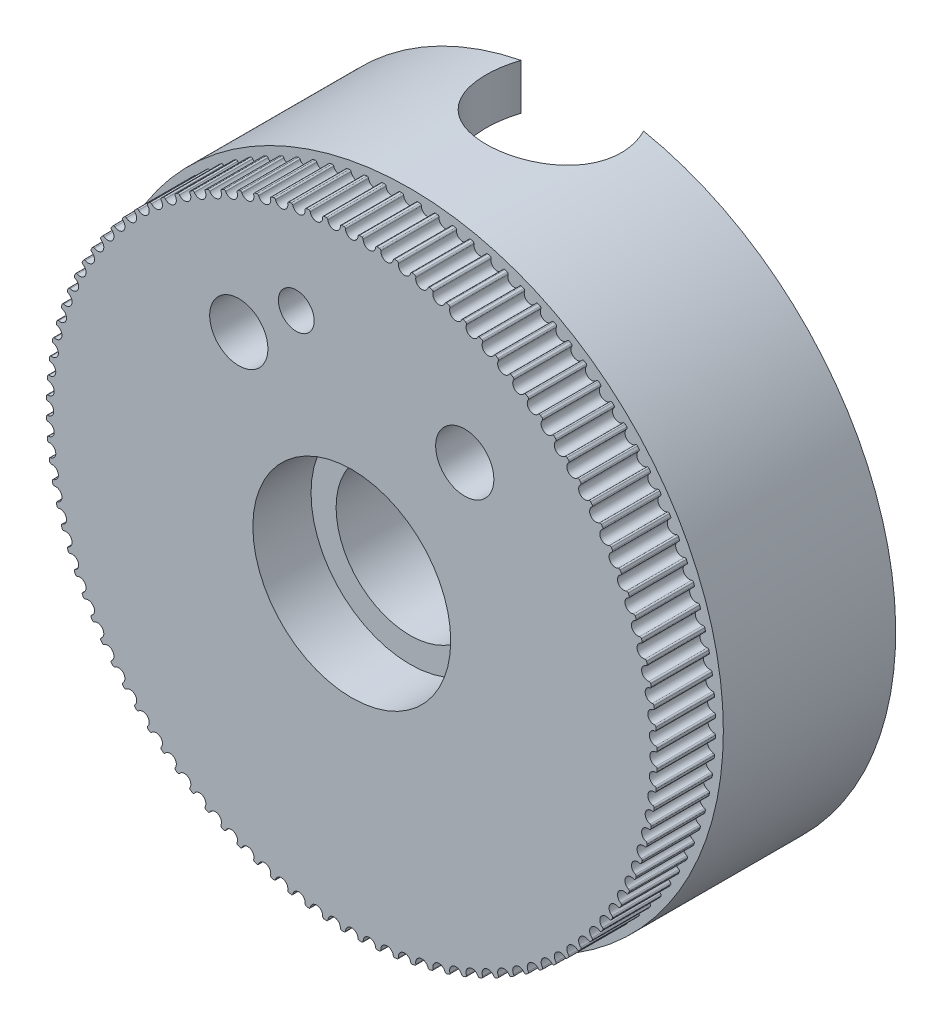
from build123d import *

# Parameters (mm, degrees)
SKETCH_1_R          = 35
SKETCH_1_R_2        = 8.25
EXTRUDE_1_DEPTH     = 19.25
SKETCH_2_R          = 7.55
CUT_EXTRUDE_1_DEPTH = 64.218371539
SKETCH_3_R          = 30
SKETCH_3_R_2        = 14.5
CUT_EXTRUDE_2_DEPTH = 8.75
SKETCH_4_R          = 8.25
EXTRUDE_2_DEPTH     = 6.5
SKETCH_6_R          = 11.05
CUT_EXTRUDE_3_DEPTH = 6.5
CUT_EXTRUDE_START   = -6.5
SKETCH_7_R          = 11.05
CUT_EXTRUDE_4_DEPTH = 6.5
SKETCH_8_R          = 1.75
CUT_EXTRUDE_5_DEPTH = 56.794825201
SKETCH_10_R         = 3.25
CUT_EXTRUDE_6_DEPTH = 10
SKETCH_12_R         = 2
CUT_EXTRUDE_7_DEPTH = 5
SKETCH_13_R         = 1.25
CUT_EXTRUDE_8_DEPTH = 54.670872158


with BuildPart() as part:
    # 草图1 → 凸台-拉伸1 (new body)
    with BuildSketch(Plane.XY):
        Circle(SKETCH_1_R)
        Circle(SKETCH_1_R_2, mode=Mode.SUBTRACT)
    extrude(amount=EXTRUDE_1_DEPTH)

    # 草图2 → 切除-拉伸1 (cut, through all)
    with BuildSketch(Plane(origin=(0, 14, 0), x_dir=(1, 0, 0), z_dir=(0, 1, 0))):
        with Locations((0, -3.2)):
            Circle(SKETCH_2_R)
    extrude(amount=CUT_EXTRUDE_1_DEPTH, mode=Mode.SUBTRACT)

    # 草图3 → 切除-拉伸2 (cut)
    with BuildSketch(Plane(origin=(0, 0, 0), x_dir=(-1, 0, 0), z_dir=(0, 0, -1))):
        Circle(SKETCH_3_R)
        Circle(SKETCH_3_R_2, mode=Mode.SUBTRACT)
    extrude(amount=-CUT_EXTRUDE_2_DEPTH, mode=Mode.SUBTRACT)

    # 草图4 → 凸台-拉伸2 (add)
    with BuildSketch(Plane.XY.offset(19.25)):
        with BuildLine():
            ThreePointArc((1.121572838, 34.104062524), (0.992443315, 34.108064479), (0.863299566, 34.111577508))
            ThreePointArc((0.863299566, 34.111577508), (0.749968837, 34.068493113), (0.699390809, 33.95830245))
            ThreePointArc((0.699390809, 33.95830245), (0, 33.2875), (-0.699390809, 33.95830245))
            ThreePointArc((-0.699390809, 33.95830245), (-0.749968837, 34.068493113), (-0.863299566, 34.111577508))
            ThreePointArc((-0.863299566, 34.111577508), (-0.992443315, 34.108064479), (-1.121572838, 34.104062524))
            ThreePointArc((-1.121572838, 34.104062524), (-1.232206695, 34.054461424), (-1.276292136, 33.941516335))
            ThreePointArc((-1.276292136, 33.941516335), (-1.935495992, 33.231182818), (-2.672707236, 33.860184418))
            ThreePointArc((-2.672707236, 33.860184418), (-2.729606712, 33.967247805), (-2.845250838, 34.003669713))
            ThreePointArc((-2.845250838, 34.003669713), (-2.973971832, 33.992653586), (-3.102650195, 33.981150187))
            ThreePointArc((-3.102650195, 33.981150187), (-3.210212829, 33.925200218), (-3.247656512, 33.809882874))
            ThreePointArc((-3.247656512, 33.809882874), (-3.864442879, 33.062421833), (-4.636980068, 33.64749424))
            ThreePointArc((-4.636980068, 33.64749424), (-4.700008462, 33.751068082), (-4.817574682, 33.780704262))
            ThreePointArc((-4.817574682, 33.780704262), (-4.945437369, 33.762222312), (-5.073229166, 33.743256394))
            ThreePointArc((-5.073229166, 33.743256394), (-5.17735662, 33.681146873), (-5.208031846, 33.563847471))
            ThreePointArc((-5.208031846, 33.563847471), (-5.780313714, 32.781788078), (-6.585562828, 33.320951592))
            ThreePointArc((-6.585562828, 33.320951592), (-6.65450687, 33.420685429), (-6.773597378, 33.443435601))
            ThreePointArc((-6.773597378, 33.443435601), (-6.900169112, 33.417550366), (-7.026641935, 33.391186103))
            ThreePointArc((-7.026641935, 33.391186103), (-7.126981874, 33.323127188), (-7.15078485, 33.204242632))
            ThreePointArc((-7.15078485, 33.204242632), (-7.676625797, 32.390231129), (-8.511862127, 32.881661392))
            ThreePointArc((-8.511862127, 32.881661392), (-8.586488534, 32.977217756), (-8.706700364, 32.993004941))
            ThreePointArc((-8.706700364, 32.993004941), (-8.831552867, 32.959804008), (-8.956278772, 32.926130608))
            ThreePointArc((-8.956278772, 32.926130608), (-9.052491678, 32.85235259), (-9.06934186, 32.732285148))
            ThreePointArc((-9.06934186, 32.732285148), (-9.546962609, 31.889075891), (-10.40935998, 32.331110058))
            ThreePointArc((-10.40935998, 32.331110058), (-10.489416239, 32.422165616), (-10.610342633, 32.430936395))
            ThreePointArc((-10.610342633, 32.430936395), (-10.733053442, 32.390532105), (-10.855610397, 32.349663509))
            ThreePointArc((-10.855610397, 32.349663509), (-10.947370715, 32.270416029), (-10.957211089, 32.149571971))
            ThreePointArc((-10.957211089, 32.149571971), (-11.384995521, 31.280018114), (-12.271635853, 31.671160482))
            ThreePointArc((-12.271635853, 31.671160482), (-12.35685108, 31.75740713), (-12.47808286, 31.759131827))
            ThreePointArc((-12.47808286, 31.759131827), (-12.598236762, 31.711660895), (-12.718210072, 31.663735389))
            ThreePointArc((-12.718210072, 31.663735389), (-12.805207316, 31.579286595), (-12.808004584, 31.458074819))
            ThreePointArc((-12.808004584, 31.458074819), (-13.184505212, 30.565118658), (-14.092388395, 30.904045724))
            ThreePointArc((-14.092388395, 30.904045724), (-14.182474247, 30.985191632), (-14.303601206, 30.979864409))
            ThreePointArc((-14.303601206, 30.979864409), (-14.420791636, 30.925487463), (-14.53777535, 30.870667212))
            ThreePointArc((-14.53777535, 30.870667212), (-14.619715148, 30.781302852), (-14.615459846, 30.6601335))
            ThreePointArc((-14.615459846, 30.6601335), (-14.939402711, 29.746796515), (-15.865456755, 30.032361457))
            ThreePointArc((-15.865456755, 30.032361457), (-15.960108412, 30.108132053), (-16.080720692, 30.095770937))
            ThreePointArc((-16.080720692, 30.095770937), (-16.194551117, 30.034671971), (-16.308149399, 29.973142469))
            ThreePointArc((-16.308149399, 29.973142469), (-16.384754491, 29.879164923), (-16.373461017, 29.758447995))
            ThreePointArc((-16.373461017, 29.758447995), (-16.64375, 28.827820628), (-17.584841432, 29.059057186))
            ThreePointArc((-17.584841432, 29.059057186), (-17.683738622, 29.129196086), (-17.80342811, 29.109842902))
            ThreePointArc((-17.80342811, 29.109842902), (-17.913513362, 29.042228655), (-18.023341832, 28.974198099))
            ThreePointArc((-18.023341832, 28.974198099), (-18.094353013, 28.875925358), (-18.07605958, 28.756069321))
            ThreePointArc((-18.07605958, 28.756069321), (-18.291780108, 27.811300522), (-19.244724572, 27.987426264))
            ThreePointArc((-19.244724572, 27.987426264), (-19.347532657, 28.05169614), (-19.465894362, 28.025416374))
            ThreePointArc((-19.465894362, 28.025416374), (-19.571861949, 27.951515631), (-19.677548981, 27.877214214))
            ThreePointArc((-19.677548981, 27.877214214), (-19.742725971, 27.774978803), (-19.717494479, 27.656389212))
            ThreePointArc((-19.717494479, 27.656389212), (-19.877916621, 26.700675779), (-20.839489656, 26.821094751))
            ThreePointArc((-20.839489656, 26.821094751), (-20.945860767, 26.879278133), (-21.06249419, 26.846160708))
            ThreePointArc((-21.06249419, 26.846160708), (-21.163985551, 26.766223526), (-21.265173534, 26.685902661))
            ThreePointArc((-21.265173534, 26.685902661), (-21.324295793, 26.580050511), (-21.292211618, 26.463128635))
            ThreePointArc((-21.292211618, 26.463128635), (-21.396792557, 25.4997044), (-22.363740503, 25.564009143))
            ThreePointArc((-22.363740503, 25.564009143), (-22.473314714, 25.615909158), (-22.587825205, 25.576066132))
            ThreePointArc((-22.587825205, 25.576066132), (-22.684496924, 25.490362993), (-22.78084347, 25.40429446))
            ThreePointArc((-22.78084347, 25.40429446), (-22.833710949, 25.295183742), (-22.794882653, 25.180325208))
            ThreePointArc((-22.794882653, 25.180325208), (-22.843268521, 24.212450094), (-23.812319532, 24.22042302))
            ThreePointArc((-23.812319532, 24.22042302), (-23.924726078, 24.265864055), (-24.036726169, 24.219430244))
            ThreePointArc((-24.036726169, 24.219430244), (-24.128251141, 24.128251141), (-24.219430244, 24.036726169))
            ThreePointArc((-24.219430244, 24.036726169), (-24.265864055, 23.924726078), (-24.22042302, 23.812319532))
            ThreePointArc((-24.22042302, 23.812319532), (-24.212450094, 22.843268521), (-25.180325208, 22.794882653))
            ThreePointArc((-25.180325208, 22.794882653), (-25.295183742, 22.833710949), (-25.40429446, 22.78084347))
            ThreePointArc((-25.40429446, 22.78084347), (-25.490362993, 22.684496924), (-25.576066132, 22.587825205))
            ThreePointArc((-25.576066132, 22.587825205), (-25.615909158, 22.473314714), (-25.564009143, 22.363740503))
            ThreePointArc((-25.564009143, 22.363740503), (-25.4997044, 21.396792557), (-26.463128635, 21.292211618))
            ThreePointArc((-26.463128635, 21.292211618), (-26.580050511, 21.324295793), (-26.685902661, 21.265173534))
            ThreePointArc((-26.685902661, 21.265173534), (-26.766223526, 21.163985551), (-26.846160708, 21.06249419))
            ThreePointArc((-26.846160708, 21.06249419), (-26.879278133, 20.945860767), (-26.821094751, 20.839489656))
            ThreePointArc((-26.821094751, 20.839489656), (-26.700675779, 19.877916621), (-27.656389212, 19.717494479))
            ThreePointArc((-27.656389212, 19.717494479), (-27.774978803, 19.742725971), (-27.877214214, 19.677548981))
            ThreePointArc((-27.877214214, 19.677548981), (-27.951515631, 19.571861949), (-28.025416374, 19.465894362))
            ThreePointArc((-28.025416374, 19.465894362), (-28.05169614, 19.347532657), (-27.987426264, 19.244724572))
            ThreePointArc((-27.987426264, 19.244724572), (-27.811300522, 18.291780108), (-28.756069321, 18.07605958))
            ThreePointArc((-28.756069321, 18.07605958), (-28.875925358, 18.094353013), (-28.974198099, 18.023341832))
            ThreePointArc((-28.974198099, 18.023341832), (-29.042228655, 17.913513362), (-29.109842902, 17.80342811))
            ThreePointArc((-29.109842902, 17.80342811), (-29.129196086, 17.683738622), (-29.059057186, 17.584841432))
            ThreePointArc((-29.059057186, 17.584841432), (-28.827820628, 16.64375), (-29.758447995, 16.373461017))
            ThreePointArc((-29.758447995, 16.373461017), (-29.879164923, 16.384754491), (-29.973142469, 16.308149399))
            ThreePointArc((-29.973142469, 16.308149399), (-30.034671971, 16.194551117), (-30.095770937, 16.080720692))
            ThreePointArc((-30.095770937, 16.080720692), (-30.108132053, 15.960108412), (-30.032361457, 15.865456755))
            ThreePointArc((-30.032361457, 15.865456755), (-29.746796515, 14.939402711), (-30.6601335, 14.615459846))
            ThreePointArc((-30.6601335, 14.615459846), (-30.781302852, 14.619715148), (-30.870667212, 14.53777535))
            ThreePointArc((-30.870667212, 14.53777535), (-30.925487463, 14.420791636), (-30.979864409, 14.303601206))
            ThreePointArc((-30.979864409, 14.303601206), (-30.985191632, 14.182474247), (-30.904045724, 14.092388395))
            ThreePointArc((-30.904045724, 14.092388395), (-30.565118658, 13.184505212), (-31.458074819, 12.808004584))
            ThreePointArc((-31.458074819, 12.808004584), (-31.579286595, 12.805207316), (-31.663735389, 12.718210072))
            ThreePointArc((-31.663735389, 12.718210072), (-31.711660895, 12.598236762), (-31.759131827, 12.47808286))
            ThreePointArc((-31.759131827, 12.47808286), (-31.75740713, 12.35685108), (-31.671160482, 12.271635853))
            ThreePointArc((-31.671160482, 12.271635853), (-31.280018114, 11.384995521), (-32.149571971, 10.957211089))
            ThreePointArc((-32.149571971, 10.957211089), (-32.270416029, 10.947370715), (-32.349663509, 10.855610397))
            ThreePointArc((-32.349663509, 10.855610397), (-32.390532105, 10.733053442), (-32.430936395, 10.610342633))
            ThreePointArc((-32.430936395, 10.610342633), (-32.422165616, 10.489416239), (-32.331110058, 10.40935998))
            ThreePointArc((-32.331110058, 10.40935998), (-31.889075891, 9.546962609), (-32.732285148, 9.06934186))
            ThreePointArc((-32.732285148, 9.06934186), (-32.85235259, 9.052491678), (-32.926130608, 8.956278772))
            ThreePointArc((-32.926130608, 8.956278772), (-32.959804008, 8.831552867), (-32.993004941, 8.706700364))
            ThreePointArc((-32.993004941, 8.706700364), (-32.977217756, 8.586488534), (-32.881661392, 8.511862127))
            ThreePointArc((-32.881661392, 8.511862127), (-32.390231129, 7.676625797), (-33.204242632, 7.15078485))
            ThreePointArc((-33.204242632, 7.15078485), (-33.323127188, 7.126981874), (-33.391186103, 7.026641935))
            ThreePointArc((-33.391186103, 7.026641935), (-33.417550366, 6.900169112), (-33.443435601, 6.773597378))
            ThreePointArc((-33.443435601, 6.773597378), (-33.420685429, 6.65450687), (-33.320951592, 6.585562828))
            ThreePointArc((-33.320951592, 6.585562828), (-32.781788078, 5.780313714), (-33.563847471, 5.208031846))
            ThreePointArc((-33.563847471, 5.208031846), (-33.681146873, 5.17735662), (-33.743256394, 5.073229166))
            ThreePointArc((-33.743256394, 5.073229166), (-33.762222312, 4.945437369), (-33.780704262, 4.817574682))
            ThreePointArc((-33.780704262, 4.817574682), (-33.751068082, 4.700008462), (-33.64749424, 4.636980068))
            ThreePointArc((-33.64749424, 4.636980068), (-33.062421833, 3.864442879), (-33.809882874, 3.247656512))
            ThreePointArc((-33.809882874, 3.247656512), (-33.925200218, 3.210212829), (-33.981150187, 3.102650195))
            ThreePointArc((-33.981150187, 3.102650195), (-33.992653586, 2.973971832), (-34.003669713, 2.845250838))
            ThreePointArc((-34.003669713, 2.845250838), (-33.967247805, 2.729606712), (-33.860184418, 2.672707236))
            ThreePointArc((-33.860184418, 2.672707236), (-33.231182818, 1.935495992), (-33.941516335, 1.276292136))
            ThreePointArc((-33.941516335, 1.276292136), (-34.054461424, 1.232206695), (-34.104062524, 1.121572838))
            ThreePointArc((-34.104062524, 1.121572838), (-34.108064479, 0.992443315), (-34.111577508, 0.863299566))
            ThreePointArc((-34.111577508, 0.863299566), (-34.068493113, 0.749968837), (-33.95830245, 0.699390809))
            ThreePointArc((-33.95830245, 0.699390809), (-33.2875, 0), (-33.95830245, -0.699390809))
            ThreePointArc((-33.95830245, -0.699390809), (-34.068493113, -0.749968837), (-34.111577508, -0.863299566))
            ThreePointArc((-34.111577508, -0.863299566), (-34.108064479, -0.992443315), (-34.104062524, -1.121572838))
            ThreePointArc((-34.104062524, -1.121572838), (-34.054461424, -1.232206695), (-33.941516335, -1.276292136))
            ThreePointArc((-33.941516335, -1.276292136), (-33.231182818, -1.935495992), (-33.860184418, -2.672707236))
            ThreePointArc((-33.860184418, -2.672707236), (-33.967247805, -2.729606712), (-34.003669713, -2.845250838))
            ThreePointArc((-34.003669713, -2.845250838), (-33.992653586, -2.973971832), (-33.981150187, -3.102650195))
            ThreePointArc((-33.981150187, -3.102650195), (-33.925200218, -3.210212829), (-33.809882874, -3.247656512))
            ThreePointArc((-33.809882874, -3.247656512), (-33.062421833, -3.864442879), (-33.64749424, -4.636980068))
            ThreePointArc((-33.64749424, -4.636980068), (-33.751068082, -4.700008462), (-33.780704262, -4.817574682))
            ThreePointArc((-33.780704262, -4.817574682), (-33.762222312, -4.945437369), (-33.743256394, -5.073229166))
            ThreePointArc((-33.743256394, -5.073229166), (-33.681146873, -5.17735662), (-33.563847471, -5.208031846))
            ThreePointArc((-33.563847471, -5.208031846), (-32.781788078, -5.780313714), (-33.320951592, -6.585562828))
            ThreePointArc((-33.320951592, -6.585562828), (-33.420685429, -6.65450687), (-33.443435601, -6.773597378))
            ThreePointArc((-33.443435601, -6.773597378), (-33.417550366, -6.900169112), (-33.391186103, -7.026641935))
            ThreePointArc((-33.391186103, -7.026641935), (-33.323127188, -7.126981874), (-33.204242632, -7.15078485))
            ThreePointArc((-33.204242632, -7.15078485), (-32.390231129, -7.676625797), (-32.881661392, -8.511862127))
            ThreePointArc((-32.881661392, -8.511862127), (-32.977217756, -8.586488534), (-32.993004941, -8.706700364))
            ThreePointArc((-32.993004941, -8.706700364), (-32.959804008, -8.831552867), (-32.926130608, -8.956278772))
            ThreePointArc((-32.926130608, -8.956278772), (-32.85235259, -9.052491678), (-32.732285148, -9.06934186))
            ThreePointArc((-32.732285148, -9.06934186), (-31.889075891, -9.546962609), (-32.331110058, -10.40935998))
            ThreePointArc((-32.331110058, -10.40935998), (-32.422165616, -10.489416239), (-32.430936395, -10.610342633))
            ThreePointArc((-32.430936395, -10.610342633), (-32.390532105, -10.733053442), (-32.349663509, -10.855610397))
            ThreePointArc((-32.349663509, -10.855610397), (-32.270416029, -10.947370715), (-32.149571971, -10.957211089))
            ThreePointArc((-32.149571971, -10.957211089), (-31.280018114, -11.384995521), (-31.671160482, -12.271635853))
            ThreePointArc((-31.671160482, -12.271635853), (-31.75740713, -12.35685108), (-31.759131827, -12.47808286))
            ThreePointArc((-31.759131827, -12.47808286), (-31.711660895, -12.598236762), (-31.663735389, -12.718210072))
            ThreePointArc((-31.663735389, -12.718210072), (-31.579286595, -12.805207316), (-31.458074819, -12.808004584))
            ThreePointArc((-31.458074819, -12.808004584), (-30.565118658, -13.184505212), (-30.904045724, -14.092388395))
            ThreePointArc((-30.904045724, -14.092388395), (-30.985191632, -14.182474247), (-30.979864409, -14.303601206))
            ThreePointArc((-30.979864409, -14.303601206), (-30.925487463, -14.420791636), (-30.870667212, -14.53777535))
            ThreePointArc((-30.870667212, -14.53777535), (-30.781302852, -14.619715148), (-30.6601335, -14.615459846))
            ThreePointArc((-30.6601335, -14.615459846), (-29.746796515, -14.939402711), (-30.032361457, -15.865456755))
            ThreePointArc((-30.032361457, -15.865456755), (-30.108132053, -15.960108412), (-30.095770937, -16.080720692))
            ThreePointArc((-30.095770937, -16.080720692), (-30.034671971, -16.194551117), (-29.973142469, -16.308149399))
            ThreePointArc((-29.973142469, -16.308149399), (-29.879164923, -16.384754491), (-29.758447995, -16.373461017))
            ThreePointArc((-29.758447995, -16.373461017), (-28.827820628, -16.64375), (-29.059057186, -17.584841432))
            ThreePointArc((-29.059057186, -17.584841432), (-29.129196086, -17.683738622), (-29.109842902, -17.80342811))
            ThreePointArc((-29.109842902, -17.80342811), (-29.042228655, -17.913513362), (-28.974198099, -18.023341832))
            ThreePointArc((-28.974198099, -18.023341832), (-28.875925358, -18.094353013), (-28.756069321, -18.07605958))
            ThreePointArc((-28.756069321, -18.07605958), (-27.811300522, -18.291780108), (-27.987426264, -19.244724572))
            ThreePointArc((-27.987426264, -19.244724572), (-28.05169614, -19.347532657), (-28.025416374, -19.465894362))
            ThreePointArc((-28.025416374, -19.465894362), (-27.951515631, -19.571861949), (-27.877214214, -19.677548981))
            ThreePointArc((-27.877214214, -19.677548981), (-27.774978803, -19.742725971), (-27.656389212, -19.717494479))
            ThreePointArc((-27.656389212, -19.717494479), (-26.700675779, -19.877916621), (-26.821094751, -20.839489656))
            ThreePointArc((-26.821094751, -20.839489656), (-26.879278133, -20.945860767), (-26.846160708, -21.06249419))
            ThreePointArc((-26.846160708, -21.06249419), (-26.766223526, -21.163985551), (-26.685902661, -21.265173534))
            ThreePointArc((-26.685902661, -21.265173534), (-26.580050511, -21.324295793), (-26.463128635, -21.292211618))
            ThreePointArc((-26.463128635, -21.292211618), (-25.4997044, -21.396792557), (-25.564009143, -22.363740503))
            ThreePointArc((-25.564009143, -22.363740503), (-25.615909158, -22.473314714), (-25.576066132, -22.587825205))
            ThreePointArc((-25.576066132, -22.587825205), (-25.490362993, -22.684496924), (-25.40429446, -22.78084347))
            ThreePointArc((-25.40429446, -22.78084347), (-25.295183742, -22.833710949), (-25.180325208, -22.794882653))
            ThreePointArc((-25.180325208, -22.794882653), (-24.212450094, -22.843268521), (-24.22042302, -23.812319532))
            ThreePointArc((-24.22042302, -23.812319532), (-24.265864055, -23.924726078), (-24.219430244, -24.036726169))
            ThreePointArc((-24.219430244, -24.036726169), (-24.128251141, -24.128251141), (-24.036726169, -24.219430244))
            ThreePointArc((-24.036726169, -24.219430244), (-23.924726078, -24.265864055), (-23.812319532, -24.22042302))
            ThreePointArc((-23.812319532, -24.22042302), (-22.843268521, -24.212450094), (-22.794882653, -25.180325208))
            ThreePointArc((-22.794882653, -25.180325208), (-22.833710949, -25.295183742), (-22.78084347, -25.40429446))
            ThreePointArc((-22.78084347, -25.40429446), (-22.684496924, -25.490362993), (-22.587825205, -25.576066132))
            ThreePointArc((-22.587825205, -25.576066132), (-22.473314714, -25.615909158), (-22.363740503, -25.564009143))
            ThreePointArc((-22.363740503, -25.564009143), (-21.396792557, -25.4997044), (-21.292211618, -26.463128635))
            ThreePointArc((-21.292211618, -26.463128635), (-21.324295793, -26.580050511), (-21.265173534, -26.685902661))
            ThreePointArc((-21.265173534, -26.685902661), (-21.163985551, -26.766223526), (-21.06249419, -26.846160708))
            ThreePointArc((-21.06249419, -26.846160708), (-20.945860767, -26.879278133), (-20.839489656, -26.821094751))
            ThreePointArc((-20.839489656, -26.821094751), (-19.877916621, -26.700675779), (-19.717494479, -27.656389212))
            ThreePointArc((-19.717494479, -27.656389212), (-19.742725971, -27.774978803), (-19.677548981, -27.877214214))
            ThreePointArc((-19.677548981, -27.877214214), (-19.571861949, -27.951515631), (-19.465894362, -28.025416374))
            ThreePointArc((-19.465894362, -28.025416374), (-19.347532657, -28.05169614), (-19.244724572, -27.987426264))
            ThreePointArc((-19.244724572, -27.987426264), (-18.291780108, -27.811300522), (-18.07605958, -28.756069321))
            ThreePointArc((-18.07605958, -28.756069321), (-18.094353013, -28.875925358), (-18.023341832, -28.974198099))
            ThreePointArc((-18.023341832, -28.974198099), (-17.913513362, -29.042228655), (-17.80342811, -29.109842902))
            ThreePointArc((-17.80342811, -29.109842902), (-17.683738622, -29.129196086), (-17.584841432, -29.059057186))
            ThreePointArc((-17.584841432, -29.059057186), (-16.64375, -28.827820628), (-16.373461017, -29.758447995))
            ThreePointArc((-16.373461017, -29.758447995), (-16.384754491, -29.879164923), (-16.308149399, -29.973142469))
            ThreePointArc((-16.308149399, -29.973142469), (-16.194551117, -30.034671971), (-16.080720692, -30.095770937))
            ThreePointArc((-16.080720692, -30.095770937), (-15.960108412, -30.108132053), (-15.865456755, -30.032361457))
            ThreePointArc((-15.865456755, -30.032361457), (-14.939402711, -29.746796515), (-14.615459846, -30.6601335))
            ThreePointArc((-14.615459846, -30.6601335), (-14.619715148, -30.781302852), (-14.53777535, -30.870667212))
            ThreePointArc((-14.53777535, -30.870667212), (-14.420791636, -30.925487463), (-14.303601205, -30.979864409))
            ThreePointArc((-14.303601205, -30.979864409), (-14.182474247, -30.985191632), (-14.092388395, -30.904045724))
            ThreePointArc((-14.092388395, -30.904045724), (-13.184505212, -30.565118658), (-12.808004584, -31.458074819))
            ThreePointArc((-12.808004584, -31.458074819), (-12.805207316, -31.579286595), (-12.718210072, -31.663735389))
            ThreePointArc((-12.718210072, -31.663735389), (-12.598236762, -31.711660895), (-12.47808286, -31.759131827))
            ThreePointArc((-12.47808286, -31.759131827), (-12.35685108, -31.75740713), (-12.271635853, -31.671160482))
            ThreePointArc((-12.271635853, -31.671160482), (-11.384995521, -31.280018114), (-10.957211089, -32.149571971))
            ThreePointArc((-10.957211089, -32.149571971), (-10.947370715, -32.270416029), (-10.855610397, -32.349663509))
            ThreePointArc((-10.855610397, -32.349663509), (-10.733053442, -32.390532105), (-10.610342633, -32.430936395))
            ThreePointArc((-10.610342633, -32.430936395), (-10.489416239, -32.422165616), (-10.40935998, -32.331110058))
            ThreePointArc((-10.40935998, -32.331110058), (-9.546962609, -31.889075891), (-9.06934186, -32.732285148))
            ThreePointArc((-9.06934186, -32.732285148), (-9.052491678, -32.85235259), (-8.956278772, -32.926130608))
            ThreePointArc((-8.956278772, -32.926130608), (-8.831552867, -32.959804008), (-8.706700364, -32.993004941))
            ThreePointArc((-8.706700364, -32.993004941), (-8.586488534, -32.977217756), (-8.511862127, -32.881661392))
            ThreePointArc((-8.511862127, -32.881661392), (-7.676625797, -32.390231129), (-7.15078485, -33.204242632))
            ThreePointArc((-7.15078485, -33.204242632), (-7.126981874, -33.323127188), (-7.026641935, -33.391186103))
            ThreePointArc((-7.026641935, -33.391186103), (-6.900169112, -33.417550366), (-6.773597378, -33.443435601))
            ThreePointArc((-6.773597378, -33.443435601), (-6.65450687, -33.420685429), (-6.585562828, -33.320951592))
            ThreePointArc((-6.585562828, -33.320951592), (-5.780313714, -32.781788078), (-5.208031846, -33.563847471))
            ThreePointArc((-5.208031846, -33.563847471), (-5.17735662, -33.681146873), (-5.073229166, -33.743256394))
            ThreePointArc((-5.073229166, -33.743256394), (-4.945437369, -33.762222312), (-4.817574682, -33.780704262))
            ThreePointArc((-4.817574682, -33.780704262), (-4.700008462, -33.751068082), (-4.636980068, -33.64749424))
            ThreePointArc((-4.636980068, -33.64749424), (-3.864442879, -33.062421833), (-3.247656512, -33.809882874))
            ThreePointArc((-3.247656512, -33.809882874), (-3.210212829, -33.925200218), (-3.102650195, -33.981150187))
            ThreePointArc((-3.102650195, -33.981150187), (-2.973971832, -33.992653586), (-2.845250838, -34.003669713))
            ThreePointArc((-2.845250838, -34.003669713), (-2.729606712, -33.967247805), (-2.672707236, -33.860184418))
            ThreePointArc((-2.672707236, -33.860184418), (-1.935495992, -33.231182818), (-1.276292136, -33.941516335))
            ThreePointArc((-1.276292136, -33.941516335), (-1.232206695, -34.054461424), (-1.121572838, -34.104062524))
            ThreePointArc((-1.121572838, -34.104062524), (-0.992443315, -34.108064479), (-0.863299566, -34.111577508))
            ThreePointArc((-0.863299566, -34.111577508), (-0.749968837, -34.068493113), (-0.699390809, -33.95830245))
            ThreePointArc((-0.699390809, -33.95830245), (0, -33.2875), (0.699390809, -33.95830245))
            ThreePointArc((0.699390809, -33.95830245), (0.749968837, -34.068493113), (0.863299566, -34.111577508))
            ThreePointArc((0.863299566, -34.111577508), (0.992443315, -34.108064479), (1.121572838, -34.104062524))
            ThreePointArc((1.121572838, -34.104062524), (1.232206695, -34.054461424), (1.276292136, -33.941516335))
            ThreePointArc((1.276292136, -33.941516335), (1.935495992, -33.231182818), (2.672707236, -33.860184418))
            ThreePointArc((2.672707236, -33.860184418), (2.729606712, -33.967247805), (2.845250838, -34.003669713))
            ThreePointArc((2.845250838, -34.003669713), (2.973971832, -33.992653586), (3.102650195, -33.981150187))
            ThreePointArc((3.102650195, -33.981150187), (3.210212829, -33.925200218), (3.247656512, -33.809882874))
            ThreePointArc((3.247656512, -33.809882874), (3.864442879, -33.062421833), (4.636980068, -33.64749424))
            ThreePointArc((4.636980068, -33.64749424), (4.700008462, -33.751068082), (4.817574682, -33.780704262))
            ThreePointArc((4.817574682, -33.780704262), (4.945437369, -33.762222312), (5.073229166, -33.743256394))
            ThreePointArc((5.073229166, -33.743256394), (5.17735662, -33.681146873), (5.208031846, -33.563847471))
            ThreePointArc((5.208031846, -33.563847471), (5.780313714, -32.781788078), (6.585562828, -33.320951592))
            ThreePointArc((6.585562828, -33.320951592), (6.65450687, -33.420685429), (6.773597378, -33.443435601))
            ThreePointArc((6.773597378, -33.443435601), (6.900169112, -33.417550366), (7.026641935, -33.391186103))
            ThreePointArc((7.026641935, -33.391186103), (7.126981874, -33.323127188), (7.15078485, -33.204242632))
            ThreePointArc((7.15078485, -33.204242632), (7.676625797, -32.390231129), (8.511862127, -32.881661392))
            ThreePointArc((8.511862127, -32.881661392), (8.586488534, -32.977217756), (8.706700364, -32.993004941))
            ThreePointArc((8.706700364, -32.993004941), (8.831552867, -32.959804008), (8.956278772, -32.926130608))
            ThreePointArc((8.956278772, -32.926130608), (9.052491678, -32.85235259), (9.06934186, -32.732285148))
            ThreePointArc((9.06934186, -32.732285148), (9.546962609, -31.889075891), (10.40935998, -32.331110058))
            ThreePointArc((10.40935998, -32.331110058), (10.489416239, -32.422165616), (10.610342633, -32.430936395))
            ThreePointArc((10.610342633, -32.430936395), (10.733053442, -32.390532105), (10.855610397, -32.349663509))
            ThreePointArc((10.855610397, -32.349663509), (10.947370715, -32.270416029), (10.957211089, -32.149571971))
            ThreePointArc((10.957211089, -32.149571971), (11.384995521, -31.280018114), (12.271635853, -31.671160482))
            ThreePointArc((12.271635853, -31.671160482), (12.35685108, -31.75740713), (12.47808286, -31.759131827))
            ThreePointArc((12.47808286, -31.759131827), (12.598236762, -31.711660895), (12.718210072, -31.663735389))
            ThreePointArc((12.718210072, -31.663735389), (12.805207316, -31.579286595), (12.808004584, -31.458074819))
            ThreePointArc((12.808004584, -31.458074819), (13.184505212, -30.565118658), (14.092388395, -30.904045724))
            ThreePointArc((14.092388395, -30.904045724), (14.182474247, -30.985191632), (14.303601205, -30.979864409))
            ThreePointArc((14.303601205, -30.979864409), (14.420791636, -30.925487463), (14.53777535, -30.870667212))
            ThreePointArc((14.53777535, -30.870667212), (14.619715148, -30.781302852), (14.615459846, -30.6601335))
            ThreePointArc((14.615459846, -30.6601335), (14.939402711, -29.746796515), (15.865456755, -30.032361457))
            ThreePointArc((15.865456755, -30.032361457), (15.960108412, -30.108132053), (16.080720692, -30.095770937))
            ThreePointArc((16.080720692, -30.095770937), (16.194551117, -30.034671971), (16.308149399, -29.973142469))
            ThreePointArc((16.308149399, -29.973142469), (16.384754491, -29.879164923), (16.373461017, -29.758447995))
            ThreePointArc((16.373461017, -29.758447995), (16.64375, -28.827820628), (17.584841432, -29.059057186))
            ThreePointArc((17.584841432, -29.059057186), (17.683738622, -29.129196086), (17.80342811, -29.109842902))
            ThreePointArc((17.80342811, -29.109842902), (17.913513362, -29.042228655), (18.023341832, -28.974198099))
            ThreePointArc((18.023341832, -28.974198099), (18.094353013, -28.875925358), (18.07605958, -28.756069321))
            ThreePointArc((18.07605958, -28.756069321), (18.291780108, -27.811300522), (19.244724572, -27.987426264))
            ThreePointArc((19.244724572, -27.987426264), (19.347532657, -28.05169614), (19.465894362, -28.025416374))
            ThreePointArc((19.465894362, -28.025416374), (19.571861949, -27.951515631), (19.677548981, -27.877214214))
            ThreePointArc((19.677548981, -27.877214214), (19.742725971, -27.774978803), (19.717494479, -27.656389212))
            ThreePointArc((19.717494479, -27.656389212), (19.877916621, -26.700675779), (20.839489656, -26.821094751))
            ThreePointArc((20.839489656, -26.821094751), (20.945860767, -26.879278133), (21.06249419, -26.846160708))
            ThreePointArc((21.06249419, -26.846160708), (21.163985551, -26.766223526), (21.265173534, -26.685902661))
            ThreePointArc((21.265173534, -26.685902661), (21.324295793, -26.580050511), (21.292211618, -26.463128635))
            ThreePointArc((21.292211618, -26.463128635), (21.396792557, -25.4997044), (22.363740503, -25.564009143))
            ThreePointArc((22.363740503, -25.564009143), (22.473314714, -25.615909158), (22.587825205, -25.576066132))
            ThreePointArc((22.587825205, -25.576066132), (22.684496924, -25.490362993), (22.78084347, -25.40429446))
            ThreePointArc((22.78084347, -25.40429446), (22.833710949, -25.295183742), (22.794882653, -25.180325208))
            ThreePointArc((22.794882653, -25.180325208), (22.843268521, -24.212450094), (23.812319532, -24.22042302))
            ThreePointArc((23.812319532, -24.22042302), (23.924726078, -24.265864055), (24.036726169, -24.219430244))
            ThreePointArc((24.036726169, -24.219430244), (24.128251141, -24.128251141), (24.219430244, -24.036726169))
            ThreePointArc((24.219430244, -24.036726169), (24.265864055, -23.924726078), (24.22042302, -23.812319532))
            ThreePointArc((24.22042302, -23.812319532), (24.212450094, -22.843268521), (25.180325208, -22.794882653))
            ThreePointArc((25.180325208, -22.794882653), (25.295183742, -22.833710949), (25.40429446, -22.78084347))
            ThreePointArc((25.40429446, -22.78084347), (25.490362993, -22.684496924), (25.576066132, -22.587825205))
            ThreePointArc((25.576066132, -22.587825205), (25.615909158, -22.473314714), (25.564009143, -22.363740503))
            ThreePointArc((25.564009143, -22.363740503), (25.4997044, -21.396792557), (26.463128635, -21.292211618))
            ThreePointArc((26.463128635, -21.292211618), (26.580050511, -21.324295793), (26.685902661, -21.265173534))
            ThreePointArc((26.685902661, -21.265173534), (26.766223526, -21.163985551), (26.846160708, -21.06249419))
            ThreePointArc((26.846160708, -21.06249419), (26.879278133, -20.945860767), (26.821094751, -20.839489656))
            ThreePointArc((26.821094751, -20.839489656), (26.700675779, -19.877916621), (27.656389212, -19.717494479))
            ThreePointArc((27.656389212, -19.717494479), (27.774978803, -19.742725971), (27.877214214, -19.677548981))
            ThreePointArc((27.877214214, -19.677548981), (27.951515631, -19.571861949), (28.025416374, -19.465894362))
            ThreePointArc((28.025416374, -19.465894362), (28.05169614, -19.347532657), (27.987426264, -19.244724572))
            ThreePointArc((27.987426264, -19.244724572), (27.811300522, -18.291780108), (28.756069321, -18.07605958))
            ThreePointArc((28.756069321, -18.07605958), (28.875925358, -18.094353013), (28.974198099, -18.023341832))
            ThreePointArc((28.974198099, -18.023341832), (29.042228655, -17.913513362), (29.109842902, -17.80342811))
            ThreePointArc((29.109842902, -17.80342811), (29.129196086, -17.683738622), (29.059057186, -17.584841432))
            ThreePointArc((29.059057186, -17.584841432), (28.827820628, -16.64375), (29.758447995, -16.373461017))
            ThreePointArc((29.758447995, -16.373461017), (29.879164923, -16.384754491), (29.973142469, -16.308149399))
            ThreePointArc((29.973142469, -16.308149399), (30.034671971, -16.194551117), (30.095770937, -16.080720692))
            ThreePointArc((30.095770937, -16.080720692), (30.108132053, -15.960108412), (30.032361457, -15.865456755))
            ThreePointArc((30.032361457, -15.865456755), (29.746796515, -14.939402711), (30.6601335, -14.615459846))
            ThreePointArc((30.6601335, -14.615459846), (30.781302852, -14.619715148), (30.870667212, -14.53777535))
            ThreePointArc((30.870667212, -14.53777535), (30.925487463, -14.420791636), (30.979864409, -14.303601206))
            ThreePointArc((30.979864409, -14.303601206), (30.985191632, -14.182474247), (30.904045724, -14.092388395))
            ThreePointArc((30.904045724, -14.092388395), (30.565118658, -13.184505212), (31.458074819, -12.808004584))
            ThreePointArc((31.458074819, -12.808004584), (31.579286595, -12.805207316), (31.663735389, -12.718210072))
            ThreePointArc((31.663735389, -12.718210072), (31.711660895, -12.598236762), (31.759131827, -12.47808286))
            ThreePointArc((31.759131827, -12.47808286), (31.75740713, -12.35685108), (31.671160482, -12.271635853))
            ThreePointArc((31.671160482, -12.271635853), (31.280018114, -11.384995521), (32.149571971, -10.957211089))
            ThreePointArc((32.149571971, -10.957211089), (32.270416029, -10.947370715), (32.349663509, -10.855610397))
            ThreePointArc((32.349663509, -10.855610397), (32.390532105, -10.733053442), (32.430936395, -10.610342633))
            ThreePointArc((32.430936395, -10.610342633), (32.422165616, -10.489416239), (32.331110058, -10.40935998))
            ThreePointArc((32.331110058, -10.40935998), (31.889075891, -9.546962609), (32.732285148, -9.06934186))
            ThreePointArc((32.732285148, -9.06934186), (32.85235259, -9.052491678), (32.926130608, -8.956278772))
            ThreePointArc((32.926130608, -8.956278772), (32.959804008, -8.831552867), (32.993004941, -8.706700364))
            ThreePointArc((32.993004941, -8.706700364), (32.977217756, -8.586488534), (32.881661392, -8.511862127))
            ThreePointArc((32.881661392, -8.511862127), (32.390231129, -7.676625797), (33.204242632, -7.15078485))
            ThreePointArc((33.204242632, -7.15078485), (33.323127188, -7.126981874), (33.391186103, -7.026641935))
            ThreePointArc((33.391186103, -7.026641935), (33.417550366, -6.900169112), (33.443435601, -6.773597378))
            ThreePointArc((33.443435601, -6.773597378), (33.420685429, -6.65450687), (33.320951592, -6.585562828))
            ThreePointArc((33.320951592, -6.585562828), (32.781788078, -5.780313714), (33.563847471, -5.208031846))
            ThreePointArc((33.563847471, -5.208031846), (33.681146873, -5.17735662), (33.743256394, -5.073229166))
            ThreePointArc((33.743256394, -5.073229166), (33.762222312, -4.945437369), (33.780704262, -4.817574682))
            ThreePointArc((33.780704262, -4.817574682), (33.751068082, -4.700008462), (33.64749424, -4.636980068))
            ThreePointArc((33.64749424, -4.636980068), (33.062421833, -3.864442879), (33.809882874, -3.247656512))
            ThreePointArc((33.809882874, -3.247656512), (33.925200218, -3.210212829), (33.981150187, -3.102650195))
            ThreePointArc((33.981150187, -3.102650195), (33.992653586, -2.973971832), (34.003669713, -2.845250838))
            ThreePointArc((34.003669713, -2.845250838), (33.967247805, -2.729606712), (33.860184418, -2.672707236))
            ThreePointArc((33.860184418, -2.672707236), (33.231182818, -1.935495992), (33.941516335, -1.276292136))
            ThreePointArc((33.941516335, -1.276292136), (34.054461424, -1.232206695), (34.104062524, -1.121572838))
            ThreePointArc((34.104062524, -1.121572838), (34.108064479, -0.992443315), (34.111577508, -0.863299566))
            ThreePointArc((34.111577508, -0.863299566), (34.068493113, -0.749968837), (33.95830245, -0.699390809))
            ThreePointArc((33.95830245, -0.699390809), (33.2875, 0), (33.95830245, 0.699390809))
            ThreePointArc((33.95830245, 0.699390809), (34.068493113, 0.749968837), (34.111577508, 0.863299566))
            ThreePointArc((34.111577508, 0.863299566), (34.108064479, 0.992443315), (34.104062524, 1.121572838))
            ThreePointArc((34.104062524, 1.121572838), (34.054461424, 1.232206695), (33.941516335, 1.276292136))
            ThreePointArc((33.941516335, 1.276292136), (33.231182818, 1.935495992), (33.860184418, 2.672707236))
            ThreePointArc((33.860184418, 2.672707236), (33.967247805, 2.729606712), (34.003669713, 2.845250838))
            ThreePointArc((34.003669713, 2.845250838), (33.992653586, 2.973971832), (33.981150187, 3.102650195))
            ThreePointArc((33.981150187, 3.102650195), (33.925200218, 3.210212829), (33.809882874, 3.247656512))
            ThreePointArc((33.809882874, 3.247656512), (33.062421833, 3.864442879), (33.64749424, 4.636980068))
            ThreePointArc((33.64749424, 4.636980068), (33.751068082, 4.700008462), (33.780704262, 4.817574682))
            ThreePointArc((33.780704262, 4.817574682), (33.762222312, 4.945437369), (33.743256394, 5.073229166))
            ThreePointArc((33.743256394, 5.073229166), (33.681146873, 5.17735662), (33.563847471, 5.208031846))
            ThreePointArc((33.563847471, 5.208031846), (32.781788078, 5.780313714), (33.320951592, 6.585562828))
            ThreePointArc((33.320951592, 6.585562828), (33.420685429, 6.65450687), (33.443435601, 6.773597378))
            ThreePointArc((33.443435601, 6.773597378), (33.417550366, 6.900169112), (33.391186103, 7.026641935))
            ThreePointArc((33.391186103, 7.026641935), (33.323127188, 7.126981874), (33.204242632, 7.15078485))
            ThreePointArc((33.204242632, 7.15078485), (32.390231129, 7.676625797), (32.881661392, 8.511862127))
            ThreePointArc((32.881661392, 8.511862127), (32.977217756, 8.586488534), (32.993004941, 8.706700364))
            ThreePointArc((32.993004941, 8.706700364), (32.959804008, 8.831552867), (32.926130608, 8.956278772))
            ThreePointArc((32.926130608, 8.956278772), (32.85235259, 9.052491678), (32.732285148, 9.06934186))
            ThreePointArc((32.732285148, 9.06934186), (31.889075891, 9.546962609), (32.331110058, 10.40935998))
            ThreePointArc((32.331110058, 10.40935998), (32.422165616, 10.489416239), (32.430936395, 10.610342633))
            ThreePointArc((32.430936395, 10.610342633), (32.390532105, 10.733053442), (32.349663509, 10.855610397))
            ThreePointArc((32.349663509, 10.855610397), (32.270416029, 10.947370715), (32.149571971, 10.957211089))
            ThreePointArc((32.149571971, 10.957211089), (31.280018114, 11.384995521), (31.671160482, 12.271635853))
            ThreePointArc((31.671160482, 12.271635853), (31.75740713, 12.35685108), (31.759131827, 12.47808286))
            ThreePointArc((31.759131827, 12.47808286), (31.711660895, 12.598236762), (31.663735389, 12.718210072))
            ThreePointArc((31.663735389, 12.718210072), (31.579286595, 12.805207316), (31.458074819, 12.808004584))
            ThreePointArc((31.458074819, 12.808004584), (30.565118658, 13.184505212), (30.904045724, 14.092388395))
            ThreePointArc((30.904045724, 14.092388395), (30.985191632, 14.182474247), (30.979864409, 14.303601206))
            ThreePointArc((30.979864409, 14.303601206), (30.925487463, 14.420791636), (30.870667212, 14.53777535))
            ThreePointArc((30.870667212, 14.53777535), (30.781302852, 14.619715148), (30.6601335, 14.615459846))
            ThreePointArc((30.6601335, 14.615459846), (29.746796515, 14.939402711), (30.032361457, 15.865456755))
            ThreePointArc((30.032361457, 15.865456755), (30.108132053, 15.960108412), (30.095770937, 16.080720692))
            ThreePointArc((30.095770937, 16.080720692), (30.034671971, 16.194551117), (29.973142469, 16.308149399))
            ThreePointArc((29.973142469, 16.308149399), (29.879164923, 16.384754491), (29.758447995, 16.373461017))
            ThreePointArc((29.758447995, 16.373461017), (28.827820628, 16.64375), (29.059057186, 17.584841432))
            ThreePointArc((29.059057186, 17.584841432), (29.129196086, 17.683738622), (29.109842902, 17.80342811))
            ThreePointArc((29.109842902, 17.80342811), (29.042228655, 17.913513362), (28.974198099, 18.023341832))
            ThreePointArc((28.974198099, 18.023341832), (28.875925358, 18.094353013), (28.756069321, 18.07605958))
            ThreePointArc((28.756069321, 18.07605958), (27.811300522, 18.291780108), (27.987426264, 19.244724572))
            ThreePointArc((27.987426264, 19.244724572), (28.05169614, 19.347532657), (28.025416374, 19.465894362))
            ThreePointArc((28.025416374, 19.465894362), (27.951515631, 19.571861949), (27.877214214, 19.677548981))
            ThreePointArc((27.877214214, 19.677548981), (27.774978803, 19.742725971), (27.656389212, 19.717494479))
            ThreePointArc((27.656389212, 19.717494479), (26.700675779, 19.877916621), (26.821094751, 20.839489656))
            ThreePointArc((26.821094751, 20.839489656), (26.879278133, 20.945860767), (26.846160708, 21.06249419))
            ThreePointArc((26.846160708, 21.06249419), (26.766223526, 21.163985551), (26.685902661, 21.265173534))
            ThreePointArc((26.685902661, 21.265173534), (26.580050511, 21.324295793), (26.463128635, 21.292211618))
            ThreePointArc((26.463128635, 21.292211618), (25.4997044, 21.396792557), (25.564009143, 22.363740503))
            ThreePointArc((25.564009143, 22.363740503), (25.615909158, 22.473314714), (25.576066132, 22.587825205))
            ThreePointArc((25.576066132, 22.587825205), (25.490362993, 22.684496924), (25.40429446, 22.78084347))
            ThreePointArc((25.40429446, 22.78084347), (25.295183742, 22.833710949), (25.180325208, 22.794882653))
            ThreePointArc((25.180325208, 22.794882653), (24.212450094, 22.843268521), (24.22042302, 23.812319532))
            ThreePointArc((24.22042302, 23.812319532), (24.265864055, 23.924726078), (24.219430244, 24.036726169))
            ThreePointArc((24.219430244, 24.036726169), (24.128251141, 24.128251141), (24.036726169, 24.219430244))
            ThreePointArc((24.036726169, 24.219430244), (23.924726078, 24.265864055), (23.812319532, 24.22042302))
            ThreePointArc((23.812319532, 24.22042302), (22.843268521, 24.212450094), (22.794882653, 25.180325208))
            ThreePointArc((22.794882653, 25.180325208), (22.833710949, 25.295183742), (22.78084347, 25.40429446))
            ThreePointArc((22.78084347, 25.40429446), (22.684496924, 25.490362993), (22.587825205, 25.576066132))
            ThreePointArc((22.587825205, 25.576066132), (22.473314714, 25.615909158), (22.363740503, 25.564009143))
            ThreePointArc((22.363740503, 25.564009143), (21.396792557, 25.4997044), (21.292211618, 26.463128635))
            ThreePointArc((21.292211618, 26.463128635), (21.324295793, 26.580050511), (21.265173534, 26.685902661))
            ThreePointArc((21.265173534, 26.685902661), (21.163985551, 26.766223526), (21.06249419, 26.846160708))
            ThreePointArc((21.06249419, 26.846160708), (20.945860767, 26.879278133), (20.839489656, 26.821094751))
            ThreePointArc((20.839489656, 26.821094751), (19.877916621, 26.700675779), (19.717494479, 27.656389212))
            ThreePointArc((19.717494479, 27.656389212), (19.742725971, 27.774978803), (19.677548981, 27.877214214))
            ThreePointArc((19.677548981, 27.877214214), (19.571861949, 27.951515631), (19.465894362, 28.025416374))
            ThreePointArc((19.465894362, 28.025416374), (19.347532657, 28.05169614), (19.244724572, 27.987426264))
            ThreePointArc((19.244724572, 27.987426264), (18.291780108, 27.811300522), (18.07605958, 28.756069321))
            ThreePointArc((18.07605958, 28.756069321), (18.094353013, 28.875925358), (18.023341832, 28.974198099))
            ThreePointArc((18.023341832, 28.974198099), (17.913513362, 29.042228655), (17.80342811, 29.109842902))
            ThreePointArc((17.80342811, 29.109842902), (17.683738622, 29.129196086), (17.584841432, 29.059057186))
            ThreePointArc((17.584841432, 29.059057186), (16.64375, 28.827820628), (16.373461017, 29.758447995))
            ThreePointArc((16.373461017, 29.758447995), (16.384754491, 29.879164923), (16.308149399, 29.973142469))
            ThreePointArc((16.308149399, 29.973142469), (16.194551117, 30.034671971), (16.080720692, 30.095770937))
            ThreePointArc((16.080720692, 30.095770937), (15.960108412, 30.108132053), (15.865456755, 30.032361457))
            ThreePointArc((15.865456755, 30.032361457), (14.939402711, 29.746796515), (14.615459846, 30.6601335))
            ThreePointArc((14.615459846, 30.6601335), (14.619715148, 30.781302852), (14.53777535, 30.870667212))
            ThreePointArc((14.53777535, 30.870667212), (14.420791636, 30.925487463), (14.303601206, 30.979864409))
            ThreePointArc((14.303601206, 30.979864409), (14.182474247, 30.985191632), (14.092388395, 30.904045724))
            ThreePointArc((14.092388395, 30.904045724), (13.184505212, 30.565118658), (12.808004584, 31.458074819))
            ThreePointArc((12.808004584, 31.458074819), (12.805207316, 31.579286595), (12.718210072, 31.663735389))
            ThreePointArc((12.718210072, 31.663735389), (12.598236762, 31.711660895), (12.47808286, 31.759131827))
            ThreePointArc((12.47808286, 31.759131827), (12.35685108, 31.75740713), (12.271635853, 31.671160482))
            ThreePointArc((12.271635853, 31.671160482), (11.384995521, 31.280018114), (10.957211089, 32.149571971))
            ThreePointArc((10.957211089, 32.149571971), (10.947370715, 32.270416029), (10.855610397, 32.349663509))
            ThreePointArc((10.855610397, 32.349663509), (10.733053442, 32.390532105), (10.610342633, 32.430936395))
            ThreePointArc((10.610342633, 32.430936395), (10.489416239, 32.422165616), (10.40935998, 32.331110058))
            ThreePointArc((10.40935998, 32.331110058), (9.546962609, 31.889075891), (9.06934186, 32.732285148))
            ThreePointArc((9.06934186, 32.732285148), (9.052491678, 32.85235259), (8.956278772, 32.926130608))
            ThreePointArc((8.956278772, 32.926130608), (8.831552867, 32.959804008), (8.706700364, 32.993004941))
            ThreePointArc((8.706700364, 32.993004941), (8.586488534, 32.977217756), (8.511862127, 32.881661392))
            ThreePointArc((8.511862127, 32.881661392), (7.676625797, 32.390231129), (7.15078485, 33.204242632))
            ThreePointArc((7.15078485, 33.204242632), (7.126981874, 33.323127188), (7.026641935, 33.391186103))
            ThreePointArc((7.026641935, 33.391186103), (6.900169112, 33.417550366), (6.773597378, 33.443435601))
            ThreePointArc((6.773597378, 33.443435601), (6.65450687, 33.420685429), (6.585562828, 33.320951592))
            ThreePointArc((6.585562828, 33.320951592), (5.780313714, 32.781788078), (5.208031846, 33.563847471))
            ThreePointArc((5.208031846, 33.563847471), (5.17735662, 33.681146873), (5.073229166, 33.743256394))
            ThreePointArc((5.073229166, 33.743256394), (4.945437369, 33.762222312), (4.817574682, 33.780704262))
            ThreePointArc((4.817574682, 33.780704262), (4.700008462, 33.751068082), (4.636980068, 33.64749424))
            ThreePointArc((4.636980068, 33.64749424), (3.864442879, 33.062421833), (3.247656512, 33.809882874))
            ThreePointArc((3.247656512, 33.809882874), (3.210212829, 33.925200218), (3.102650195, 33.981150187))
            ThreePointArc((3.102650195, 33.981150187), (2.973971832, 33.992653586), (2.845250838, 34.003669713))
            ThreePointArc((2.845250838, 34.003669713), (2.729606712, 33.967247805), (2.672707236, 33.860184418))
            ThreePointArc((2.672707236, 33.860184418), (1.935495992, 33.231182818), (1.276292136, 33.941516335))
            ThreePointArc((1.276292136, 33.941516335), (1.232206695, 34.054461424), (1.121572838, 34.104062524))
        make_face()
        Circle(SKETCH_4_R, mode=Mode.SUBTRACT)
    extrude(amount=EXTRUDE_2_DEPTH)

    # 草图6 → 切除-拉伸3 (cut)
    with BuildSketch(Plane(origin=(0, 0, 0), x_dir=(-1, 0, 0), z_dir=(0, 0, -1))):
        Circle(SKETCH_6_R)
    extrude(amount=-CUT_EXTRUDE_3_DEPTH, mode=Mode.SUBTRACT)

    # 草图7 → 切除-拉伸4 (cut)
    with BuildSketch(Plane.XY.offset(25.75).offset(CUT_EXTRUDE_START)):
        Circle(SKETCH_7_R)
    extrude(amount=CUT_EXTRUDE_4_DEPTH, mode=Mode.SUBTRACT)

    # 草图8 → 切除-拉伸5 (cut, through all)
    with BuildSketch(Plane.XY.offset(25.75)):
        with Locations((-12.6186816, 18.021344974)):
            Circle(SKETCH_8_R)
        with Locations((12.6186816, 18.021344974)):
            Circle(SKETCH_8_R)
    extrude(amount=-CUT_EXTRUDE_5_DEPTH, mode=Mode.SUBTRACT)

    # 草图10 → 切除-拉伸6 (cut)
    with BuildSketch(Plane.XY.offset(25.75)):
        with Locations((-12.6186816, 18.021344974)):
            Circle(SKETCH_10_R)
        with Locations((12.6186816, 18.021344974)):
            Circle(SKETCH_10_R)
    extrude(amount=-CUT_EXTRUDE_6_DEPTH, mode=Mode.SUBTRACT)

    # 草图12 → 切除-拉伸7 (cut)
    with BuildSketch(Plane.XY.offset(25.75)):
        with Locations((-6.199082478, 23.309860475)):
            Circle(SKETCH_12_R)
    extrude(amount=-CUT_EXTRUDE_7_DEPTH, mode=Mode.SUBTRACT)

    # 草图13 → 切除-拉伸8 (cut, through all)
    with BuildSketch(Plane.XY.offset(20.75)):
        with Locations((-6.199082478, 23.309860475)):
            Circle(SKETCH_13_R)
    extrude(amount=-CUT_EXTRUDE_8_DEPTH, mode=Mode.SUBTRACT)


solid = part.part
